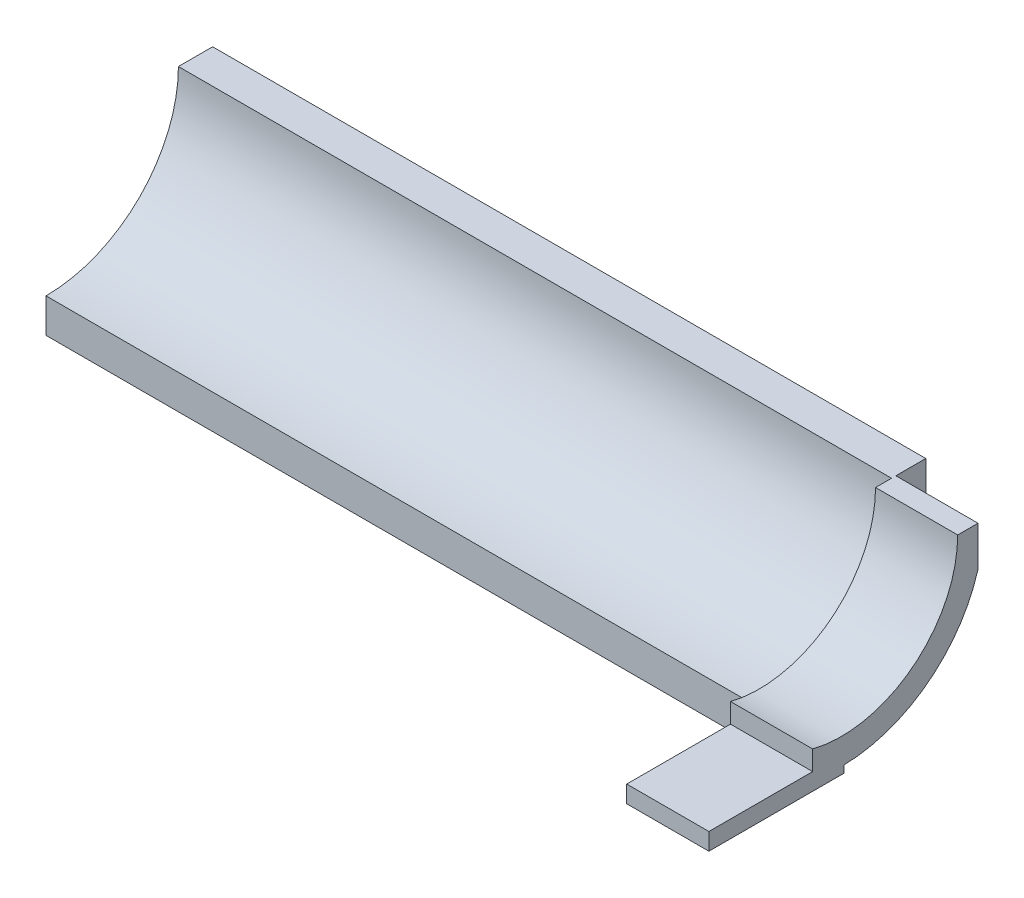
from build123d import *

# Parameters (mm, degrees)
BOSS_EXTRUDE1_DEPTH = 66.1416
BOSS_EXTRUDE2_DEPTH = 7.62


with BuildPart() as part:
    # Sketch1 → Boss-Extrude1 (new body)
    with BuildSketch(Plane(origin=(0, 0, 0), x_dir=(0, 0, -1), z_dir=(1, 0, 0))):
        with BuildLine():
            Line((34.207401555, 10.336569156), (37.382401555, 10.336569156))
            Line((37.382401555, 10.336569156), (37.382401555, -5.119330844))
            Line((37.382401555, -5.119330844), (21.926501555, -5.119330844))
            Line((21.926501555, -5.119330844), (21.926501555, -1.944330844))
            ThreePointArc((21.926501555, -1.944330844), (30.610409224, 1.652661487), (34.207401555, 10.336569156))
        make_face()
    extrude(amount=BOSS_EXTRUDE1_DEPTH)

    # Sketch2 → Boss-Extrude2 (add)
    with BuildSketch(Plane(origin=(66.1416, 0, 0), x_dir=(0, 0, -1), z_dir=(1, 0, 0))):
        with BuildLine():
            Line((9.646401555, -1.944330844), (9.646401555, -3.531830844))
            Line((9.646401555, -3.531830844), (21.926501555, -3.531830844))
            Line((21.926501555, -3.531830844), (22.19897935, -3.531830844))
            Line((22.19897935, -3.531830844), (22.19897935, -2.86861997))
            ThreePointArc((22.19897935, -2.86861997), (29.958028059, -0.148937318), (34.604876555, 6.633857804))
            Line((34.604876555, 6.633857804), (34.604876555, 10.336569156))
            Line((34.604876555, 10.336569156), (34.207401555, 10.336569156))
            Line((34.207401555, 10.336569156), (33.674001555, 10.336569156))
            Line((33.674001555, 10.336569156), (32.721501555, 10.336569156))
            ThreePointArc((32.721501555, 10.336569156), (28.553589913, 1.815200434), (19.268287124, -0.12602713))
            Line((19.268287124, -0.12602713), (19.268287124, -1.944330844))
            Line((19.268287124, -1.944330844), (9.646401555, -1.944330844))
        make_face()
    extrude(amount=BOSS_EXTRUDE2_DEPTH)


solid = part.part
